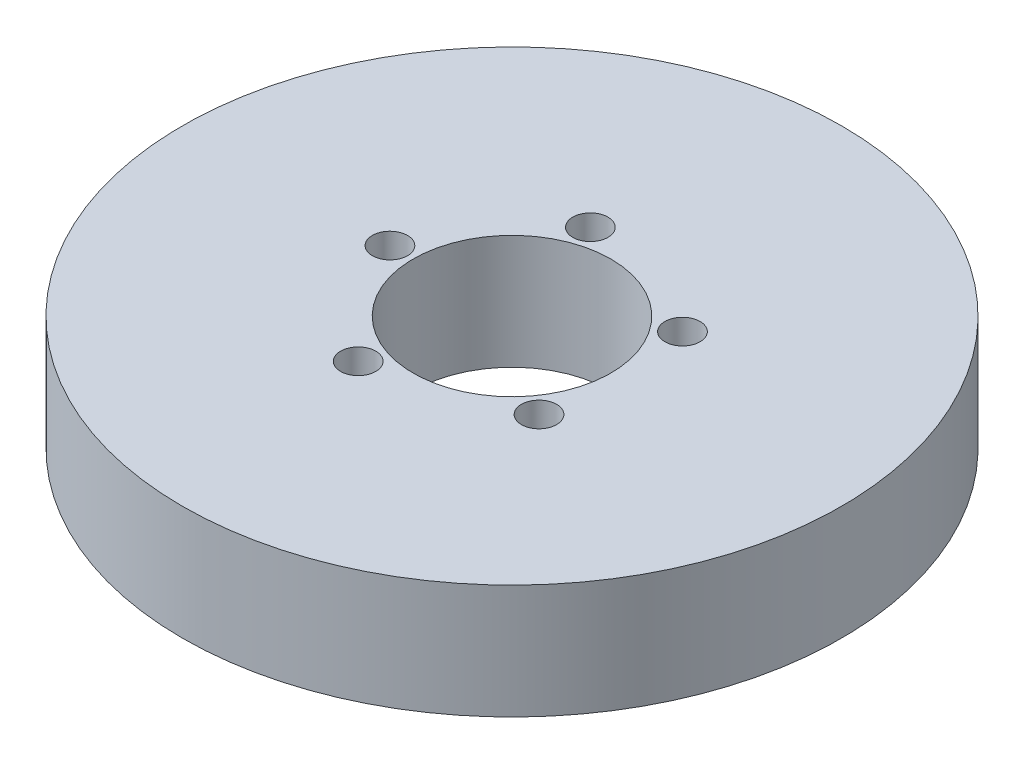
from build123d import *

# Parameters (mm, degrees)
SKETCH1_R           = 75
BOSS_EXTRUDE1_DEPTH = 26
SKETCH2_R           = 22.5
CUT_EXTRUDE1_DEPTH  = 110.206226929
SKETCH3_R           = 4.004712967
CUT_EXTRUDE2_DEPTH  = 16.510354944
CIRPATTERN1_COUNT   = 5


with BuildPart() as part:
    # Sketch1 → Boss-Extrude1 (new body)
    with BuildSketch(Plane(origin=(0, 0, 0), x_dir=(1, 0, 0), z_dir=(0, 1, 0))):
        Circle(SKETCH1_R)
    extrude(amount=BOSS_EXTRUDE1_DEPTH)

    # Sketch2 → Cut-Extrude1 (cut, through all)
    with BuildSketch(Plane(origin=(0, 0, 0), x_dir=(1, 0, 0), z_dir=(0, 1, 0))):
        Circle(SKETCH2_R)
    extrude(amount=CUT_EXTRUDE1_DEPTH, mode=Mode.SUBTRACT)

    # Sketch3 → Cut-Extrude2 (cut)
    with BuildSketch(Plane(origin=(0, 26, 0), x_dir=(1, 0, 0), z_dir=(0, 1, 0))):
        with Locations((-27.776316684, 0)):
            Circle(SKETCH3_R)
    cut_extrude2 = extrude(amount=-CUT_EXTRUDE2_DEPTH, mode=Mode.SUBTRACT)

    # CirPattern1: Cut-Extrude2 ×5 about axis
    cirpattern1_axis = Axis((0, 0, 0), (0, 1, 0))
    for i in range(1, CIRPATTERN1_COUNT):
        add(cut_extrude2.rotate(cirpattern1_axis, i * 360 / CIRPATTERN1_COUNT), mode=Mode.SUBTRACT)


solid = part.part
